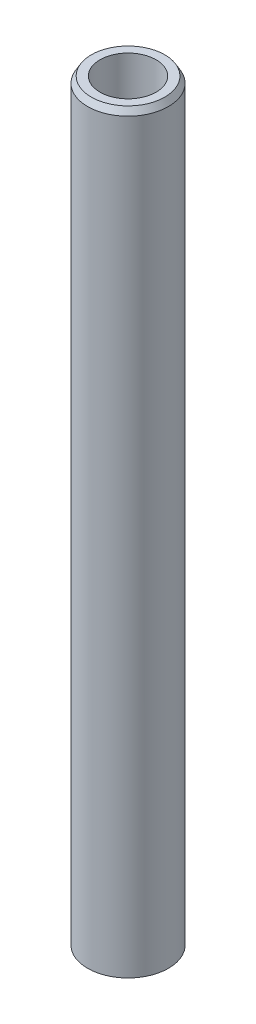
from build123d import *
from OCP.BRepFilletAPI import BRepFilletAPI_MakeChamfer

# Parameters (mm, degrees)
SKETCH1_R           = 10
BOSS_EXTRUDE1_DEPTH = 187.323336995
SKETCH2_R           = 6.954597533
CUT_EXTRUDE1_DEPTH  = 188.856414804
CHAMFER1_SIZE       = 1.570941902
CHAMFER1_SIZE2      = 0.90698373


with BuildPart() as part:
    # Sketch1 → Boss-Extrude1 (new body)
    with BuildSketch(Plane(origin=(0, 0, 0), x_dir=(1, 0, 0), z_dir=(0, 1, 0))):
        Circle(SKETCH1_R)
    extrude(amount=BOSS_EXTRUDE1_DEPTH)

    # Sketch2 → Cut-Extrude1 (cut, through all)
    with BuildSketch(Plane(origin=(0, 0, 0), x_dir=(1, 0, 0), z_dir=(0, 1, 0))):
        Circle(SKETCH2_R)
    extrude(amount=CUT_EXTRUDE1_DEPTH, mode=Mode.SUBTRACT)

    # Chamfer1: one chamfer whose edges measure the first distance from different faces: ONE call of the kernel's chamfer builder (chamfer() names one face for all edges)
    chamfer1_edges_1 = [part.edges().sort_by_distance(p)[0] for p in [
        (-10, 187.323336995, 0),
    ]]
    chamfer1_side_1 = [part.faces().sort_by_distance(p)[0] for p in [
        (-10, 93.661668497, 0),
    ]]
    chamfer1_edges_2 = [part.edges().sort_by_distance(p)[0] for p in [
        (-10, 0, 0),
    ]]
    chamfer1_side_2 = [part.faces().sort_by_distance(p)[0] for p in [
        (-9.717157288, 0, 0),
    ]]
    chamfer1 = BRepFilletAPI_MakeChamfer(part.part.solid().wrapped)
    for e in chamfer1_edges_1:
        chamfer1.Add(CHAMFER1_SIZE, CHAMFER1_SIZE2, e.wrapped, chamfer1_side_1[0].wrapped)  # the first distance lies on this face
    for e in chamfer1_edges_2:
        chamfer1.Add(CHAMFER1_SIZE, CHAMFER1_SIZE2, e.wrapped, chamfer1_side_2[0].wrapped)  # the first distance lies on this face
    add(Compound.cast(chamfer1.Shape()), mode=Mode.REPLACE)


solid = part.part
